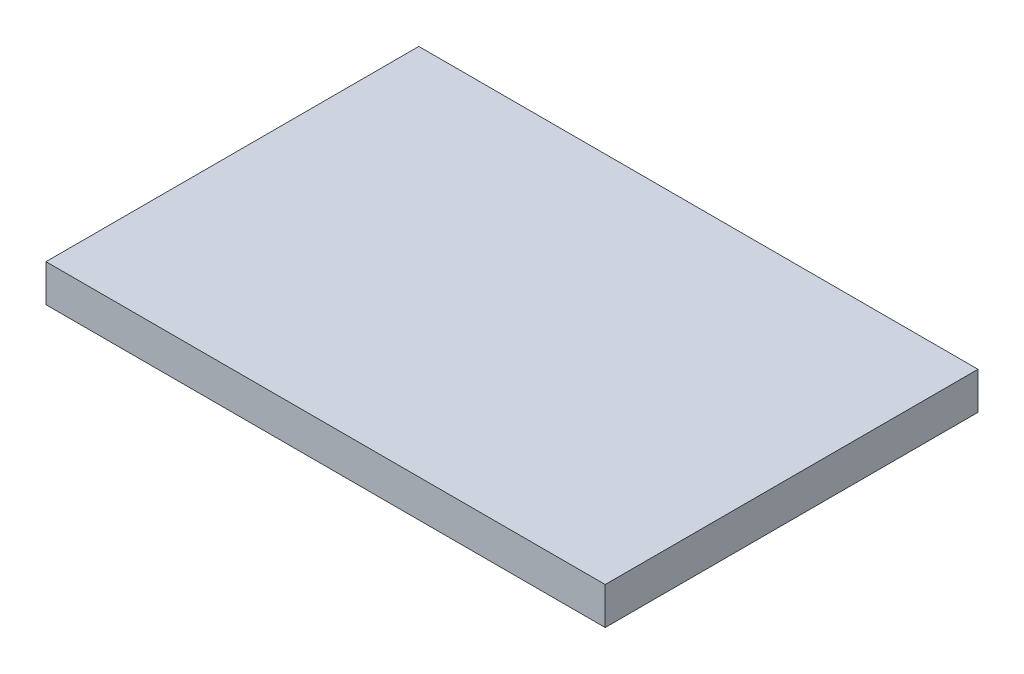
from build123d import *

# Parameters (mm, degrees)
SKETCH1_W           = 300
SKETCH1_H           = 200
BOSS_EXTRUDE1_DEPTH = 10


with BuildPart() as part:
    # Sketch1 → Boss-Extrude1 (new, symmetric)
    with BuildSketch(Plane(origin=(0, 0, 0), x_dir=(1, 0, 0), z_dir=(0, 1, 0))):
        Rectangle(SKETCH1_W, SKETCH1_H)
    extrude(amount=BOSS_EXTRUDE1_DEPTH, both=True)


solid = part.part
